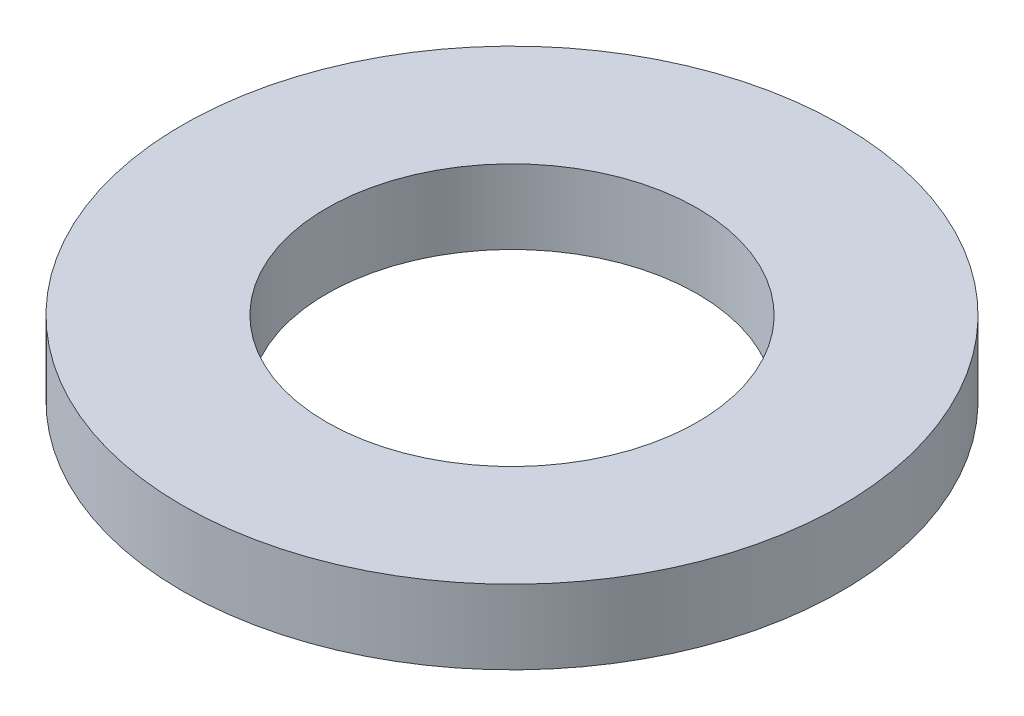
from build123d import *

# Parameters (mm, degrees)
SKETCH1_R           = 80
BOSS_EXTRUDE1_DEPTH = 18
SKETCH2_R           = 45
CUT_EXTRUDE1_DEPTH  = 115.560027933


with BuildPart() as part:
    # Sketch1 → Boss-Extrude1 (new body)
    with BuildSketch(Plane(origin=(0, 0, 0), x_dir=(1, 0, 0), z_dir=(0, 1, 0))):
        Circle(SKETCH1_R)
    extrude(amount=BOSS_EXTRUDE1_DEPTH)

    # Sketch2 → Cut-Extrude1 (cut, through all)
    with BuildSketch(Plane(origin=(0, 0, 0), x_dir=(1, 0, 0), z_dir=(0, 1, 0))):
        Circle(SKETCH2_R)
    extrude(amount=CUT_EXTRUDE1_DEPTH, mode=Mode.SUBTRACT)


solid = part.part
